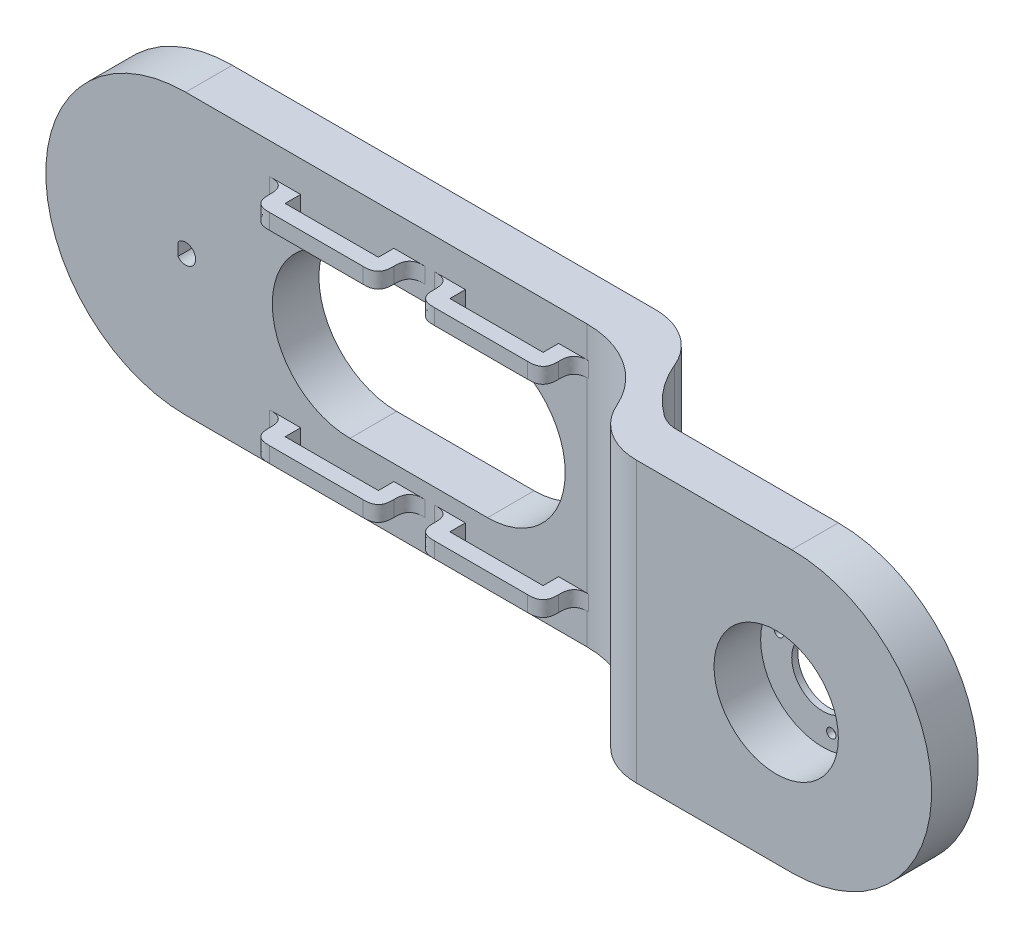
from build123d import *

# Parameters (mm, degrees)
BOSS_EXTRU_1_DEPTH                = 15
ESQUISSE2_W                       = 15
ESQUISSE2_H                       = 90
BOSS_EXTRU_2_DEPTH                = 15
BOSS_EXTRU_3_DEPTH                = 15
ENL_V_MAT_EXTRU_2_DEPTH           = 287.181760425
ESQUISSE11_R                      = 20
ENL_V_MAT_EXTRU_3_DEPTH           = 20
BOSS_EXTRU_5_DEPTH                = 5
R_P_TITION_LIN_AIRE2_COUNT        = 2
R_P_TITION_LIN_AIRE2_PITCH        = 53
R_P_TITION_LIN_AIRE2_COPY_1_DEPTH = 5
CONG_3_SIZE                       = 5
CONG_4_R                          = 20
CONG_8_R                          = 30
ENL_V_MAT_EXTRU_4_DEPTH           = 289.140590716
CONG_9_R                          = 20
CONG_10_R                         = 10
ESQUISSE23_R                      = 20
BOSS_EXTRU_7_DEPTH                = 2
ESQUISSE24_R                      = 10
ESQUISSE24_R_2                    = 1.5
ENL_V_MAT_EXTRU_5_DEPTH           = 5
ENL_V_MAT_EXTRU_6_DEPTH           = 287.181760467


with BuildPart() as part:
    # Esquisse1 → Boss.-Extru.1 (new body)
    with BuildSketch(Plane.XY):
        with BuildLine():
            Line((0, 90), (170, 90))
            Line((170, 90), (170, 0))
            Line((170, 0), (0, 0))
            ThreePointArc((0, 0), (-45, 45), (0, 90))
        make_face()
    extrude(amount=BOSS_EXTRU_1_DEPTH)

    # Esquisse2 → Boss.-Extru.2 (add)
    with BuildSketch(Plane.XY.offset(15)):
        with Locations((162.5, 45)):
            Rectangle(ESQUISSE2_W, ESQUISSE2_H)
    extrude(amount=BOSS_EXTRU_2_DEPTH)

    # Esquisse3 → Boss.-Extru.3 (add)
    with BuildSketch(Plane.XY.offset(30)):
        with BuildLine():
            Line((155, 90), (225, 90))
            ThreePointArc((225, 90), (270, 45), (225, 0))
            Line((225, 0), (155, 0))
            Line((155, 0), (155, 90))
        make_face()
    extrude(amount=BOSS_EXTRU_3_DEPTH)

    # Esquisse10 → Enlèv. mat.-Extru.2 (cut, through all)
    with BuildSketch(Plane.XY.offset(15)):
        with BuildLine():
            Line((-2.497999199, 43), (-2.497999199, 47))
            ThreePointArc((-2.497999199, 47), (3.2, 45), (-2.497999199, 43))
        make_face()
    extrude(amount=-ENL_V_MAT_EXTRU_2_DEPTH, mode=Mode.SUBTRACT)

    # Esquisse11 → Enlèv. mat.-Extru.3 (cut)
    with BuildSketch(Plane(origin=(0, 0, 30), x_dir=(-1, 0, 0), z_dir=(0, 0, -1))):
        with Locations((-220, 45)):
            Circle(ESQUISSE11_R)
    extrude(amount=-ENL_V_MAT_EXTRU_3_DEPTH, mode=Mode.SUBTRACT)

    # Esquisse20 → Boss.-Extru.5 (add)
    with BuildSketch(Plane(origin=(0, 10, 0), x_dir=(1, 0, 0), z_dir=(0, 1, 0))):
        Polygon((125, -25), (125, -15), (120, -15), (120, -20), (90, -20), (90, -15), (85, -15), (85, -25), align=None)
    boss_extru_5 = extrude(amount=BOSS_EXTRU_5_DEPTH)

    # Symétrie2: Boss.-Extru.5 across plane
    add(boss_extru_5.mirror(Plane(origin=(170, 45, 0), x_dir=(0, 0, 1), z_dir=(0, -1, 0))))

    # Répétition linéaire2: Boss.-Extru.5 ×2
    with Locations(*[(-i * R_P_TITION_LIN_AIRE2_PITCH, 0, 0) for i in range(1, R_P_TITION_LIN_AIRE2_COUNT)]):
        add(boss_extru_5)

    # Répétition linéaire2 copy 1 sketch → Répétition linéaire2 copy 1 (add)
    with BuildSketch(Plane(origin=(-53, 80, 0), x_dir=(1, 0, 0), z_dir=(0, -1, 0))):
        Polygon((125, 25), (125, 15), (120, 15), (120, 20), (90, 20), (90, 15), (85, 15), (85, 25), align=None)
    extrude(amount=R_P_TITION_LIN_AIRE2_COPY_1_DEPTH)

    # Congé3
    # a fillet whose section is not a circle: 5 mm, written as the material it adds along each edge
    with BuildSketch(Plane(origin=(125, 80, 15), x_dir=(1, 0, 0), z_dir=(0, -1, 0)), Plane(origin=(72, 80, 15), x_dir=(1, 0, 0), z_dir=(0, -1, 0)), Plane(origin=(32, 10, 15), x_dir=(-1, 0, 0), z_dir=(0, 1, 0)), Plane(origin=(85, 10, 15), x_dir=(-1, 0, 0), z_dir=(0, 1, 0))) as cong_3_piece_1:
        with BuildLine():
            add(Edge.make_bspline([(CONG_3_SIZE, 0), (CONG_3_SIZE * 0.831801948466, 0), (CONG_3_SIZE * 0.663603896932, 0), (CONG_3_SIZE * 0.292893218813, CONG_3_SIZE * 0.0716919198361), (CONG_3_SIZE * 0.0716919198361, CONG_3_SIZE * 0.292893218813), (0, CONG_3_SIZE * 0.663603896932), (0, CONG_3_SIZE * 0.831801948466), (0, CONG_3_SIZE)], knots=[0, 0, 0, 0, 0, 0, 0.5, 0.5, 1, 1, 1, 1, 1, 1], degree=5))
            Line((0, CONG_3_SIZE), (0, 0))
            Line((0, 0), (CONG_3_SIZE, 0))
        make_face()
    extrude(amount=5)
    with BuildSketch(Plane(origin=(85, 80, 15), x_dir=(-1, 0, 0), z_dir=(0, -1, 0)), Plane(origin=(32, 80, 15), x_dir=(-1, 0, 0), z_dir=(0, -1, 0)), Plane(origin=(72, 10, 15), x_dir=(1, 0, 0), z_dir=(0, 1, 0)), Plane(origin=(125, 10, 15), x_dir=(1, 0, 0), z_dir=(0, 1, 0))) as cong_3_piece_2:
        with BuildLine():
            add(Edge.make_bspline([(CONG_3_SIZE, 0), (CONG_3_SIZE * 0.831801948466, 0), (CONG_3_SIZE * 0.663603896932, 0), (CONG_3_SIZE * 0.292893218813, -CONG_3_SIZE * 0.0716919198361), (CONG_3_SIZE * 0.0716919198361, -CONG_3_SIZE * 0.292893218813), (0, -CONG_3_SIZE * 0.663603896932), (0, -CONG_3_SIZE * 0.831801948466), (0, -CONG_3_SIZE)], knots=[0, 0, 0, 0, 0, 0, 0.5, 0.5, 1, 1, 1, 1, 1, 1], degree=5))
            Line((0, -CONG_3_SIZE), (0, 0))
            Line((0, 0), (CONG_3_SIZE, 0))
        make_face()
    extrude(amount=5)
    # a fillet whose section is not a circle: 5 mm, written as the material it takes off along each edge
    with BuildSketch(Plane(origin=(125, 92.5, 25), x_dir=(-1, 0, 0), z_dir=(0, -1, 0)), Plane(origin=(85, 92.5, 25), x_dir=(0, 0, -1), z_dir=(0, -1, 0)), Plane(origin=(32, 92.5, 25), x_dir=(0, 0, -1), z_dir=(0, -1, 0)), Plane(origin=(72, 92.5, 25), x_dir=(-1, 0, 0), z_dir=(0, -1, 0))) as cong_3_2_piece_1:
        with BuildLine():
            add(Edge.make_bspline([(CONG_3_SIZE, 0), (CONG_3_SIZE * 0.831801948466, 0), (CONG_3_SIZE * 0.663603896932, 0), (CONG_3_SIZE * 0.292893218813, CONG_3_SIZE * 0.0716919198361), (CONG_3_SIZE * 0.0716919198361, CONG_3_SIZE * 0.292893218813), (0, CONG_3_SIZE * 0.663603896932), (0, CONG_3_SIZE * 0.831801948466), (0, CONG_3_SIZE)], knots=[0, 0, 0, 0, 0, 0, 0.5, 0.5, 1, 1, 1, 1, 1, 1], degree=5))
            Line((0, CONG_3_SIZE), (0, 0))
            Line((0, 0), (CONG_3_SIZE, 0))
        make_face()
    extrude(amount=30, mode=Mode.SUBTRACT)
    with BuildSketch(Plane(origin=(32, -2.5, 25), x_dir=(0, 0, -1), z_dir=(0, 1, 0)), Plane(origin=(72, -2.5, 25), x_dir=(-1, 0, 0), z_dir=(0, 1, 0)), Plane(origin=(85, -2.5, 25), x_dir=(0, 0, -1), z_dir=(0, 1, 0)), Plane(origin=(125, -2.5, 25), x_dir=(-1, 0, 0), z_dir=(0, 1, 0))) as cong_3_2_piece_2:
        with BuildLine():
            add(Edge.make_bspline([(CONG_3_SIZE, 0), (CONG_3_SIZE * 0.831801948466, 0), (CONG_3_SIZE * 0.663603896932, 0), (CONG_3_SIZE * 0.292893218813, -CONG_3_SIZE * 0.0716919198361), (CONG_3_SIZE * 0.0716919198361, -CONG_3_SIZE * 0.292893218813), (0, -CONG_3_SIZE * 0.663603896932), (0, -CONG_3_SIZE * 0.831801948466), (0, -CONG_3_SIZE)], knots=[0, 0, 0, 0, 0, 0, 0.5, 0.5, 1, 1, 1, 1, 1, 1], degree=5))
            Line((0, -CONG_3_SIZE), (0, 0))
            Line((0, 0), (CONG_3_SIZE, 0))
        make_face()
    extrude(amount=30, mode=Mode.SUBTRACT)

    # Congé4
    cong_4_edges = [part.edges().sort_by_distance(p)[0] for p in [
        (155, 45, 45),
    ]]
    fillet(cong_4_edges, radius=CONG_4_R)

    # Congé8
    # the kernel refuses this fillet: 30 mm, written as the material it adds along each edge
    with BuildSketch(Plane(origin=(155, 90, 15), x_dir=(0.09236442858628174, 0, 0.9957252695055648), z_dir=(0, -1, 0))) as cong_8_piece_1:
        with BuildLine():
            CenterArc((27.486376802, 28.486291656), CONG_8_R, 185.299645608, 66.421821522)
            Line((-2.385381283, 25.715358799), (-5.372557092, 25.438265513))
            Line((-5.372557092, 25.438265513), (-2.987175809, -0.277093286))
            Line((-2.987175809, -0.277093286), (0.277093286, -2.987175809))
            ThreePointArc((0.277093286, -2.987175809), (10.234345981, -2.063531523), (17.136365349, -2.848629166))
            Line((17.136365349, -2.848629166), (18.077275481, 0))
        make_face()
    extrude(amount=90)
    # the kernel refuses this fillet: 30 mm, written as the material it takes off along each edge
    with BuildSketch(Plane(origin=(170, 165, 0), x_dir=(-1, 0, 0), z_dir=(0, -1, 0))) as cong_8_2_piece_1:
        with BuildLine():
            CenterArc((CONG_8_R, -CONG_8_R), CONG_8_R, 90, 90)
            Line((0, -CONG_8_R), (0, 0))
            Line((0, 0), (CONG_8_R, 0))
        make_face()
    extrude(amount=240, mode=Mode.SUBTRACT)

    # Esquisse21 → Enlèv. mat.-Extru.4 (cut, through all)
    with BuildSketch(Plane(origin=(0, 90, 0), x_dir=(1, 0, 0), z_dir=(0, 1, 0))):
        with BuildLine():
            ThreePointArc((170, -30), (157.850911613, -18.385534141), (152.154704801, -2.57258395))
            ThreePointArc((152.154704801, -2.57258395), (165.145985207, -13.639088412), (170, -30))
        make_face()
    extrude(amount=-ENL_V_MAT_EXTRU_4_DEPTH, mode=Mode.SUBTRACT)

    # Congé9
    cong_9_edges = [part.edges().sort_by_distance(p)[0] for p in [
        (152.154704801, 45, 2.57258395),
    ]]
    fillet(cong_9_edges, radius=CONG_9_R)

    # Congé10
    cong_10_edges = [part.edges().sort_by_distance(p)[0] for p in [
        (170, 45, 30),
    ]]
    fillet(cong_10_edges, radius=CONG_10_R)

    # Esquisse25 → Enlèv. mat.-Extru.6 (cut, through all)
    with BuildSketch(Plane.XY.offset(15)):
        with BuildLine():
            Line((52.876767067, 70), (97.123232933, 70))
            ThreePointArc((97.123232933, 70), (122.123232933, 45), (97.123232933, 20))
            Line((97.123232933, 20), (52.876767067, 20))
            ThreePointArc((52.876767067, 20), (27.876767067, 45), (52.876767067, 70))
        make_face()
    extrude(amount=-ENL_V_MAT_EXTRU_6_DEPTH, mode=Mode.SUBTRACT)


with BuildPart() as body_2:
    # Esquisse23 → Boss.-Extru.7 (new body)
    with BuildSketch(Plane(origin=(0, 0, 30), x_dir=(-1, 0, 0), z_dir=(0, 0, -1))):
        with Locations((-220, 45)):
            Circle(ESQUISSE23_R)
    extrude(amount=BOSS_EXTRU_7_DEPTH)

    # Esquisse24 → Enlèv. mat.-Extru.5 (cut)
    with BuildSketch(Plane(origin=(0, 0, 28), x_dir=(-1, 0, 0), z_dir=(0, 0, -1))):
        with Locations((-220, 45)):
            Circle(ESQUISSE24_R)
        with Locations((-205.863175268, 50.014996162)):
            Circle(ESQUISSE24_R_2)
        with Locations((-222.725298289, 30.249652572)):
            Circle(ESQUISSE24_R_2)
        with Locations((-231.411526442, 54.735351265)):
            Circle(ESQUISSE24_R_2)
    extrude(amount=-ENL_V_MAT_EXTRU_5_DEPTH, mode=Mode.SUBTRACT)


solid = Compound([part.part, body_2.part])
